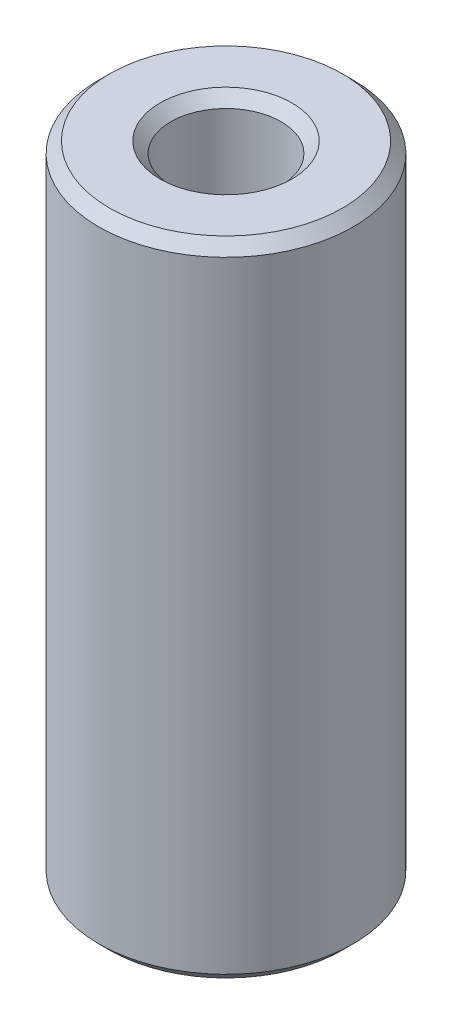
from build123d import *

# Parameters (mm, degrees)
SKETCH1_R           = 17.5
BOSS_EXTRUDE1_DEPTH = 88.390727874
SKETCH2_R           = 7.583345478
CUT_EXTRUDE1_DEPTH  = 92.790090827
CHAMFER1_SIZE       = 1.489320136


with BuildPart() as part:
    # Sketch1 → Boss-Extrude1 (new body)
    with BuildSketch(Plane(origin=(0, 0, 0), x_dir=(1, 0, 0), z_dir=(0, 1, 0))):
        Circle(SKETCH1_R)
    extrude(amount=BOSS_EXTRUDE1_DEPTH)

    # Sketch2 → Cut-Extrude1 (cut, through all)
    with BuildSketch(Plane(origin=(0, 0, 0), x_dir=(1, 0, 0), z_dir=(0, 1, 0))):
        Circle(SKETCH2_R)
    extrude(amount=CUT_EXTRUDE1_DEPTH, mode=Mode.SUBTRACT)

    # Chamfer1
    chamfer1_edges = [part.edges().sort_by_distance(p)[0] for p in [
        (-7.583345478, 88.390727874, 0),
        (-7.583345478, 0, 0),
        (-17.5, 0, 0),
        (-17.5, 88.390727874, 0),
    ]]
    chamfer(chamfer1_edges, length=CHAMFER1_SIZE)


solid = part.part
